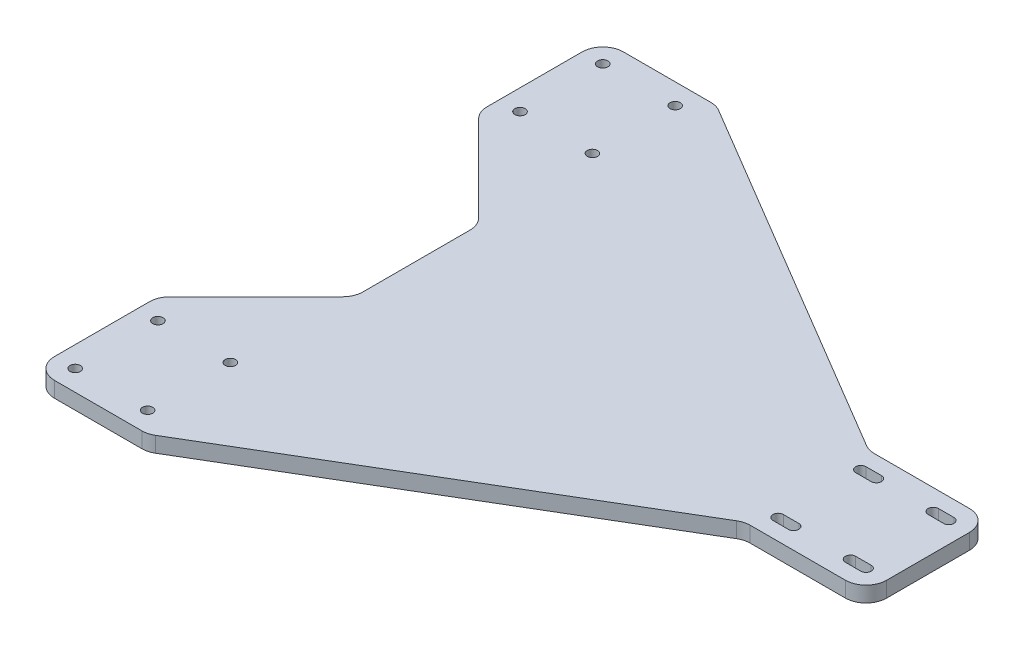
from build123d import *

# Parameters (mm, degrees)
ESQUISSE1_W             = 117.9
ESQUISSE1_H             = 110
BOSS_EXTRU_1_DEPTH      = 3
ESQUISSE2_R             = 1
ENL_V_MAT_EXTRU_1_DEPTH = 81.679009042
CONG_1_R                = 4


with BuildPart() as part:
    # Esquisse1 → Boss.-Extru.1 (new body)
    with BuildSketch(Plane(origin=(0, 0, 0), x_dir=(1, 0, 0), z_dir=(0, 1, 0))):
        Rectangle(ESQUISSE1_W, ESQUISSE1_H)
    extrude(amount=BOSS_EXTRU_1_DEPTH)

    # Esquisse2 → Enlèv. mat.-Extru.1 (cut, through all)
    with BuildSketch(Plane(origin=(0, 0, 0), x_dir=(1, 0, 0), z_dir=(0, 1, 0))):
        with Locations((-40.95, -35)):
            Circle(ESQUISSE2_R)
        with Locations((-54.95, -35)):
            Circle(ESQUISSE2_R)
        with Locations((-54.95, -51)):
            Circle(ESQUISSE2_R)
        with Locations((-40.95, -51)):
            Circle(ESQUISSE2_R)
        with Locations((-40.95, 51)):
            Circle(ESQUISSE2_R)
        with Locations((-54.95, 51)):
            Circle(ESQUISSE2_R)
        with Locations((-54.95, 35)):
            Circle(ESQUISSE2_R)
        with Locations((-40.95, 35)):
            Circle(ESQUISSE2_R)
        Polygon((58.95, 12), (35.45, 12), (-36.95, 55), (58.95, 55), align=None)
        Polygon((58.95, -12), (35.45, -12), (-36.95, -55), (58.95, -55), align=None)
        Polygon((-58.95, -31), (-39.95, -12), (-39.95, 12), (-58.95, 31), align=None)
        with BuildLine():
            Line((37.95, 9), (40.95, 9))
            ThreePointArc((40.95, 9), (41.95, 8), (40.95, 7))
            Line((40.95, 7), (37.95, 7))
            ThreePointArc((37.95, 7), (36.95, 8), (37.95, 9))
        make_face()
        with BuildLine():
            Line((54.95, 7), (51.95, 7))
            ThreePointArc((51.95, 7), (50.95, 8), (51.95, 9))
            Line((51.95, 9), (54.95, 9))
            ThreePointArc((54.95, 9), (55.95, 8), (54.95, 7))
        make_face()
        with BuildLine():
            Line((37.95, -7), (40.95, -7))
            ThreePointArc((40.95, -7), (41.95, -8), (40.95, -9))
            Line((40.95, -9), (37.95, -9))
            ThreePointArc((37.95, -9), (36.95, -8), (37.95, -7))
        make_face()
        with BuildLine():
            Line((54.95, -9), (51.95, -9))
            ThreePointArc((51.95, -9), (50.95, -8), (51.95, -7))
            Line((51.95, -7), (54.95, -7))
            ThreePointArc((54.95, -7), (55.95, -8), (54.95, -9))
        make_face()
    extrude(amount=ENL_V_MAT_EXTRU_1_DEPTH, mode=Mode.SUBTRACT)

    # Congé1
    cong_1_edges = [part.edges().sort_by_distance(p)[0] for p in [
        (35.45, 1.5, 12),
        (58.95, 1.5, 12),
        (58.95, 1.5, -12),
        (35.45, 1.5, -12),
        (-36.95, 1.5, -55),
        (-58.95, 1.5, -55),
        (-58.95, 1.5, -31),
        (-39.95, 1.5, -12),
        (-39.95, 1.5, 12),
        (-58.95, 1.5, 31),
        (-58.95, 1.5, 55),
        (-36.95, 1.5, 55),
    ]]
    fillet(cong_1_edges, radius=CONG_1_R)


solid = part.part
